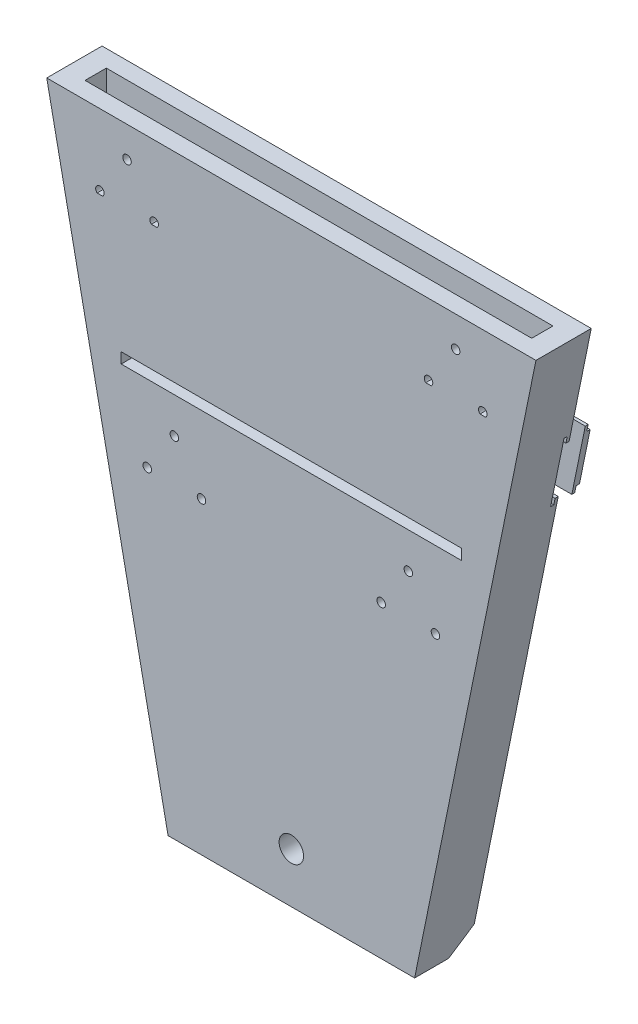
from build123d import *

# Parameters (mm, degrees)
EXTRUDE_1_DEPTH      = 8
CUT_EXTRUDE_1_DEPTH  = 8.6
EXTRUDE_2_DEPTH      = 8
EXTRUDE_3_DEPTH      = 10
SKETCH_7_R           = 5.75
CUT_EXTRUDE_2_DEPTH  = 22
EXTRUDE_5_DEPTH      = 26
CUT_EXTRUDE_4_DEPTH  = 21
CHAMFER_6_SIZE       = 5
CHAMFER_8_SIZE       = 10
SKETCH_13_W          = 210
SKETCH_13_H          = 10
CUT_EXTRUDE_5_DEPTH  = 15
SKETCH_14_W          = 160
SKETCH_14_H          = 5
CUT_EXTRUDE_6_DEPTH  = 10
SKETCH_16_R          = 2
CUT_EXTRUDE_7_DEPTH  = 10
SKETCH_18_W          = 109.386418102
SKETCH_18_H          = 16
EXTRUDE_7_DEPTH      = 2
CHAMFER_10_SIZE      = 2
SKETCH_32_W          = 100
SKETCH_32_H          = 25
CUT_EXTRUDE_16_DEPTH = 3
SKETCH_33_W          = 3
SKETCH_33_H          = 25
CUT_EXTRUDE_17_DEPTH = 1003
SKETCH_34_W          = 1.5
SKETCH_34_H          = 25
CUT_EXTRUDE_19_DEPTH = 3
SKETCH_36_W          = 111.215468024
SKETCH_36_H          = 1.5
CUT_EXTRUDE_20_DEPTH = 3
CUT_EXTRUDE_21_DEPTH = 3
SKETCH_38_W          = 1.5
SKETCH_38_H          = 31
CUT_EXTRUDE_22_DEPTH = 1003
EXTRUDE_8_DEPTH      = 1.35
EXTRUDE_9_DEPTH      = 1.6


with BuildPart() as part:
    # 草图1 → 凸台-拉伸1 (new body)
    with BuildSketch(Plane.XY):
        Polygon((-60, 0), (60, 0), (115, 270), (-115, 270), align=None)
    extrude(amount=EXTRUDE_1_DEPTH)

    # 草图2 → 切除-拉伸1 (cut)
    with BuildSketch(Plane.XY.offset(8)):
        with BuildLine():
            Line((0.005000474, 0.310000947), (0, 0.3))
            Line((0, 0.3), (17.48870838, 0.3))
            Line((17.48870838, 0.3), (12.108893566, 26.71))
            Line((12.108893566, 26.71), (0, 26.71))
            ThreePointArc((0, 26.71), (-13.199999763, 13.507499763), (0.005000474, 0.310000947))
        make_face()
    extrude(amount=-CUT_EXTRUDE_1_DEPTH, mode=Mode.SUBTRACT)

    # 草图5 → 凸台-拉伸2 (add)
    with BuildSketch(Plane(origin=(0, 0, 0), x_dir=(-1, 0, 0), z_dir=(0, 0, -1))):
        Polygon((60, 0), (115, 270), (-115, 270), (-60, 0), align=None)
    extrude(amount=EXTRUDE_2_DEPTH)

    # 草图6 → 凸台-拉伸3 (add)
    with BuildSketch(Plane.XY.offset(8)):
        Polygon((-115, 270), (-60, 0), (60, 0), (115, 270), align=None)
    extrude(amount=EXTRUDE_3_DEPTH)

    # 草图7 → 切除-拉伸2 (cut)
    with BuildSketch(Plane.XY.offset(18)):
        with Locations((0, 13.51)):
            Circle(SKETCH_7_R)
    extrude(amount=-CUT_EXTRUDE_2_DEPTH, mode=Mode.SUBTRACT)

    # 草图9 → 凸台-拉伸5 (add)
    with BuildSketch(Plane.XY.offset(18)):
        Polygon((-57.962962963, -10), (-60, 0), (60, 0), (57.962962963, -10), align=None)
    extrude(amount=-EXTRUDE_5_DEPTH)

    # 草图12 → 切除-拉伸4 (cut)
    with BuildSketch(Plane.XY.offset(-8)):
        Polygon((54.693209051, 0), (-54.693209051, 0), (-52.656172014, -10), (52.656172014, -10), align=None)
    extrude(amount=CUT_EXTRUDE_4_DEPTH, mode=Mode.SUBTRACT)

    # 倒角6
    chamfer_6_edges = [part.edges().sort_by_distance(p)[0] for p in [
        (0, 0, -8),
    ]]
    chamfer(chamfer_6_edges, length=CHAMFER_6_SIZE)

    # 倒角8
    chamfer_8_edges = [part.edges().sort_by_distance(p)[0] for p in [
        (55.309567488, -10, -8),
        (-55.309567488, -10, -8),
    ]]
    chamfer(chamfer_8_edges, length=CHAMFER_8_SIZE)

    # 草图13 → 切除-拉伸5 (cut)
    with BuildSketch(Plane(origin=(0, 270, 0), x_dir=(1, 0, 0), z_dir=(0, 1, 0))):
        with Locations((0, -5)):
            Rectangle(SKETCH_13_W, SKETCH_13_H)
    extrude(amount=-CUT_EXTRUDE_5_DEPTH, mode=Mode.SUBTRACT)

    # 草图14 → 切除-拉伸6 (cut)
    with BuildSketch(Plane.XY.offset(18)):
        with Locations((0, 173.51)):
            Rectangle(SKETCH_14_W, SKETCH_14_H)
    extrude(amount=-CUT_EXTRUDE_6_DEPTH, mode=Mode.SUBTRACT)

    # 草图16 → 切除-拉伸7 (cut)
    with BuildSketch(Plane.XY.offset(18)):
        with BuildLine():
            ThreePointArc((-88.677124344, 235), (-90, 238.5), (-91.322875656, 235))
            Line((-91.322875656, 235), (-88.677124344, 235))
        make_face()
        with BuildLine():
            ThreePointArc((91.322875656, 235), (90, 238.5), (88.677124344, 235))
            Line((88.677124344, 235), (91.322875656, 235))
        make_face()
        with BuildLine():
            ThreePointArc((65.822875656, 235), (64.5, 238.5), (63.177124344, 235))
            Line((63.177124344, 235), (65.822875656, 235))
        make_face()
        with BuildLine():
            ThreePointArc((-63.177124344, 235), (-64.5, 238.5), (-65.822875656, 235))
            Line((-65.822875656, 235), (-63.177124344, 235))
        make_face()
        with Locations((-77.25, 255.6425573)):
            Circle(SKETCH_16_R)
        with Locations((77.25, 255.6425573)):
            Circle(SKETCH_16_R)
        with Locations((-55, 154.1525573)):
            Circle(SKETCH_16_R)
        with Locations((-67.75, 135.01)):
            Circle(SKETCH_16_R)
        with Locations((-42.25, 135.01)):
            Circle(SKETCH_16_R)
        with Locations((42.25, 135.01)):
            Circle(SKETCH_16_R)
        with Locations((67.75, 135.01)):
            Circle(SKETCH_16_R)
        with Locations((55, 154.1525573)):
            Circle(SKETCH_16_R)
    extrude(amount=-CUT_EXTRUDE_7_DEPTH, mode=Mode.SUBTRACT)

    # 草图18 → 凸台-拉伸7 (add)
    with BuildSketch(Plane.XZ):
        with Locations((0, 5)):
            Rectangle(SKETCH_18_W, SKETCH_18_H)
    extrude(amount=EXTRUDE_7_DEPTH)

    # 倒角10
    chamfer_10_edges = [part.edges().sort_by_distance(p)[0] for p in [
        (0, -2, -3),
    ]]
    chamfer(chamfer_10_edges, length=CHAMFER_10_SIZE - 0.0001)  # a hair under: the kernel refuses the full size

    # 草图32 → 切除-拉伸16 (cut)
    with BuildSketch(Plane(origin=(0, 0, -8), x_dir=(-1, 0, 0), z_dir=(0, 0, -1))):
        with Locations((-46.363148148, 206.34047939)):
            Rectangle(SKETCH_32_W, SKETCH_32_H)
    extrude(amount=-CUT_EXTRUDE_16_DEPTH, mode=Mode.SUBTRACT)

    # 草图33 → 切除-拉伸17 (cut)
    with BuildSketch(Plane(origin=(-3.636851852, 0, 0), x_dir=(0, 0, -1), z_dir=(1, 0, 0))):
        with Locations((6.5, 206.34047939)):
            Rectangle(SKETCH_33_W, SKETCH_33_H)
    extrude(amount=CUT_EXTRUDE_17_DEPTH, mode=Mode.SUBTRACT)

    # 草图34 → 切除-拉伸19 (cut)
    with BuildSketch(Plane(origin=(-3.636851852, 0, 0), x_dir=(0, 0, -1), z_dir=(1, 0, 0))):
        with Locations((5.75, 206.34047939)):
            Rectangle(SKETCH_34_W, SKETCH_34_H)
    extrude(amount=-CUT_EXTRUDE_19_DEPTH, mode=Mode.SUBTRACT)

    # 草图36 → 切除-拉伸20 (cut)
    with BuildSketch(Plane.XZ.offset(-218.84047939)):
        with Locations((48.97088216, -5.75)):
            Rectangle(SKETCH_36_W, SKETCH_36_H)
    extrude(amount=-CUT_EXTRUDE_20_DEPTH, mode=Mode.SUBTRACT)

    # 草图37 → 切除-拉伸21 (cut)
    with BuildSketch(Plane(origin=(0, 193.84047939, 0), x_dir=(1, 0, 0), z_dir=(0, 1, 0))):
        Polygon((-6.636851852, 6.5), (-6.636851852, 5), (99.486023579, 5), (99.486023579, 6.5), (-3.636851852, 6.5), align=None)
    extrude(amount=-CUT_EXTRUDE_21_DEPTH, mode=Mode.SUBTRACT)

    # 草图38 → 切除-拉伸22 (cut)
    with BuildSketch(Plane(origin=(-6.636851852, 0, 0), x_dir=(0, 0, -1), z_dir=(1, 0, 0))):
        with Locations((5.75, 206.34047939)):
            Rectangle(SKETCH_38_W, SKETCH_38_H)
    extrude(amount=CUT_EXTRUDE_22_DEPTH, mode=Mode.SUBTRACT)


with BuildPart() as body_2:
    # 草图39 → 凸台-拉伸8 (new body)
    with BuildSketch(Plane(origin=(0, 0, -15), x_dir=(-1, 0, 0), z_dir=(0, 0, -1))):
        Polygon((-105.189727283, 221.84047939), (-98.874912468, 190.84047939), (6.636851852, 190.84047939), (6.636851852, 221.84047939), align=None)
    extrude(amount=EXTRUDE_8_DEPTH)

    # 草图41 → 凸台-拉伸9 (add)
    with BuildSketch(Plane(origin=(0, 0, -16.35), x_dir=(-1, 0, 0), z_dir=(0, 0, -1))):
        Polygon((-101.272157924, 218.64047939), (-104.537875431, 218.64047939), (-99.52676432, 194.04047939), (-96.261046813, 194.04047939), (3.436851852, 194.04047939), (3.436851852, 218.64047939), align=None)
    extrude(amount=EXTRUDE_9_DEPTH)


solid = Compound([part.part, body_2.part])
